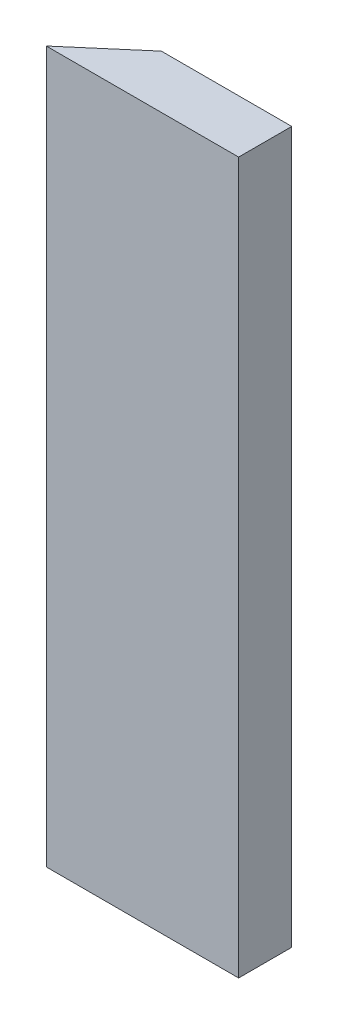
from build123d import *

# Parameters (mm, degrees)
SALIENTE_EXTRUIR1_DEPTH    = 170
CORTAR_EXTRUIR1_DEPTH      = 181.900525151
CORTAR_EXTRUIR1_DEPTH_BACK = 181.900525151
CROQUIS2_W                 = 8
CROQUIS2_H                 = 27
CORTAR_EXTRUIR2_DEPTH      = 181.900525151
CORTAR_EXTRUIR2_DEPTH_BACK = 181.900525151
CROQUIS3_W                 = 38.06511858
CROQUIS3_H                 = 175.826127046
CORTAR_EXTRUIR3_DEPTH      = 177.751237619
CORTAR_EXTRUIR3_DEPTH_BACK = 177.751237619
CROQUIS4_W                 = 35.532251822
CROQUIS4_H                 = 7.536766594


with BuildPart() as part:
    # Croquis1 → Saliente-Extruir1 (new body)
    with BuildSketch(Plane(origin=(0, 0, 0), x_dir=(1, 0, 0), z_dir=(0, 1, 0))):
        Polygon((0, 0), (17.50080029, 15), (60, 15), (60, 0), align=None)
    extrude(amount=SALIENTE_EXTRUIR1_DEPTH)

    # Croquis2 → Cortar-Extruir1 (cut, two sides: drawn at the far end of the back side and taken through both)
    with BuildSketch(Plane(origin=(0, 0, -15), x_dir=(-1, 0, 0), z_dir=(0, 0, -1)).offset(-CORTAR_EXTRUIR1_DEPTH_BACK)):
        with Locations((-56, 13.5)):
            Rectangle(CROQUIS2_W, CROQUIS2_H)
        with Locations((-56, 156.5)):
            Rectangle(CROQUIS2_W, CROQUIS2_H)
    extrude(amount=CORTAR_EXTRUIR1_DEPTH + CORTAR_EXTRUIR1_DEPTH_BACK, mode=Mode.SUBTRACT)

    # Croquis3 → Cortar-Extruir2 (cut, two sides: drawn at the far end of the back side and taken through both)
    with BuildSketch(Plane(origin=(0, 0, -15), x_dir=(-1, 0, 0), z_dir=(0, 0, -1)).offset(-CORTAR_EXTRUIR2_DEPTH_BACK)):
        with Locations((-65.03255929, 82.086936477)):
            Rectangle(CROQUIS3_W, CROQUIS3_H)
    extrude(amount=CORTAR_EXTRUIR2_DEPTH + CORTAR_EXTRUIR2_DEPTH_BACK, mode=Mode.SUBTRACT)

    # Croquis4 → Cortar-Extruir3 (cut, two sides: drawn at the far end of the back side and taken through both)
    with BuildSketch(Plane.XZ.offset(-CORTAR_EXTRUIR3_DEPTH_BACK)):
        with Locations((28.233874089, -16.468383297)):
            Rectangle(CROQUIS4_W, CROQUIS4_H)
    extrude(amount=CORTAR_EXTRUIR3_DEPTH + CORTAR_EXTRUIR3_DEPTH_BACK, mode=Mode.SUBTRACT)


solid = part.part
